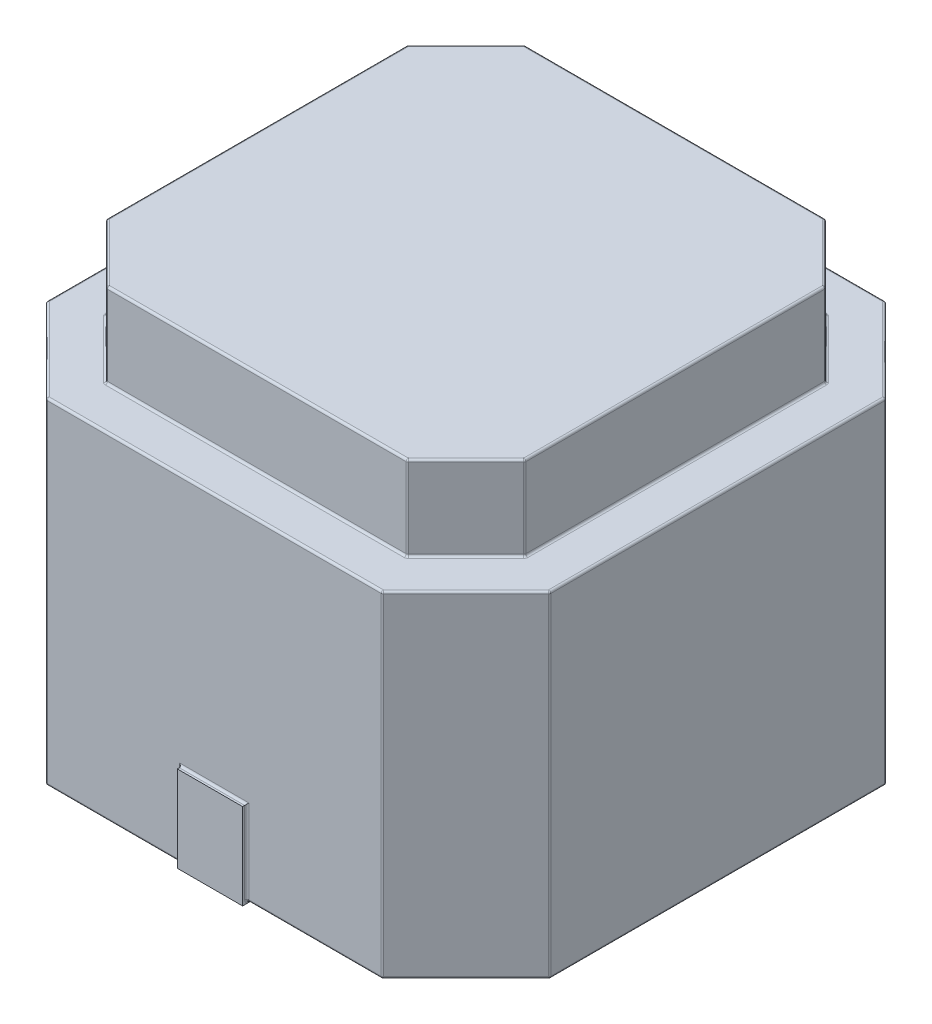
from build123d import *

# Parameters (mm, degrees)
BOSS_EXTRUDE1_DEPTH      = 5
CUT_EXTRUDE1_DEPTH       = 1
BOSS_EXTRUDE2_DEPTH      = 0.0254
BOSS_EXTRUDE2_DEPTH_BACK = 1
SKETCH3_W                = 0.777152918
SKETCH3_H                = 1.679205413
FILLET1_R                = 0.0254


with BuildPart() as part:
    # Sketch1 → Boss-Extrude1 (new body)
    with BuildSketch(Plane(origin=(0, 0, 0), x_dir=(1, 0, 0), z_dir=(0, 1, 0))):
        Polygon((-3, 2), (-2, 3), (2, 3), (3, 2), (3, -2), (2, -3), (-2, -3), (-3, -2), align=None)
    extrude(amount=BOSS_EXTRUDE1_DEPTH)

    # Sketch2 → Cut-Extrude1 (cut)
    with BuildSketch(Plane(origin=(0, 5, 0), x_dir=(1, 0, 0), z_dir=(0, 1, 0))):
        Polygon((3, -2), (3, 2), (2, 3), (-2, 3), (-3, 2), (-3, -2), (-2, -3), (2, -3), align=None)
        Polygon((2.492, -1.78957951), (2.492, 1.78957951), (1.78957951, 2.492), (-1.78957951, 2.492), (-2.492, 1.78957951), (-2.492, -1.78957951), (-1.78957951, -2.492), (1.78957951, -2.492), align=None, mode=Mode.SUBTRACT)
    extrude(amount=-CUT_EXTRUDE1_DEPTH, mode=Mode.SUBTRACT)

    # Sketch3 → Boss-Extrude2 (add, two sides: drawn at the far end of the back side and taken through both)
    with BuildSketch(Plane.XZ.offset(-BOSS_EXTRUDE2_DEPTH_BACK)):
        with Locations((0, 2.210397294)):
            Rectangle(SKETCH3_W, SKETCH3_H)
        with Locations((0, -2.210397294)):
            Rectangle(SKETCH3_W, SKETCH3_H)
    extrude(amount=BOSS_EXTRUDE2_DEPTH + BOSS_EXTRUDE2_DEPTH_BACK)

    # Fillet1
    fillet1_edges = [part.edges().sort_by_distance(p)[0] for p in [
        (0.388576459, 0, 2.185397293),
        (0.388576459, 0, -2.185397293),
        (0, 0, -1.370794587),
        (-0.388576459, 0, -2.185397293),
        (-0.388576459, 0, 2.185397293),
        (0, 0, 1.370794587),
        (1.78957951, 4.5, -2.492),
        (2.492, 4.5, -1.78957951),
        (2.492, 4.5, 1.78957951),
        (1.78957951, 4.5, 2.492),
        (-1.78957951, 4.5, 2.492),
        (-2.492, 4.5, 1.78957951),
        (-2.492, 4.5, -1.78957951),
        (-1.78957951, 4.5, -2.492),
        (0, 5, 2.492),
        (-2.140789755, 5, 2.140789755),
        (-2.492, 5, 0),
        (-2.140789755, 5, -2.140789755),
        (0, 5, -2.492),
        (2.140789755, 5, -2.140789755),
        (2.492, 5, 0),
        (2.140789755, 5, 2.140789755),
        (2.140789755, 4, -2.140789755),
        (0, 4, -2.492),
        (-2.140789755, 4, -2.140789755),
        (-2.492, 4, 0),
        (-2.140789755, 4, 2.140789755),
        (0, 4, 2.492),
        (2.140789755, 4, 2.140789755),
        (2.492, 4, 0),
        (0, 4, -3),
        (-1.19428823, 0, -3),
        (-0.388576459, 0.5, -3),
        (0, 1, -3),
        (0.388576459, 0.5, -3),
        (1.19428823, 0, -3),
        (-2.5, 0, -2.5),
        (-2, 2, -3),
        (-2.5, 4, -2.5),
        (-3, 0, 0),
        (-3, 2, -2),
        (-3, 4, 0),
        (-2.5, 0, 2.5),
        (-3, 2, 2),
        (-2.5, 4, 2.5),
        (-2, 2, 3),
        (0, 4, 3),
        (1.19428823, 0, 3),
        (0.388576459, 0.5, 3),
        (0, 1, 3),
        (-0.388576459, 0.5, 3),
        (-1.19428823, 0, 3),
        (2.5, 0, 2.5),
        (2, 2, 3),
        (2.5, 4, 2.5),
        (3, 0, 0),
        (3, 2, 2),
        (3, 4, 0),
        (2, 2, -3),
        (2.5, 0, -2.5),
        (3, 2, -2),
        (2.5, 4, -2.5),
    ]]
    fillet(fillet1_edges, radius=FILLET1_R - 0.0001)  # a hair under: the kernel refuses the full size


solid = part.part
